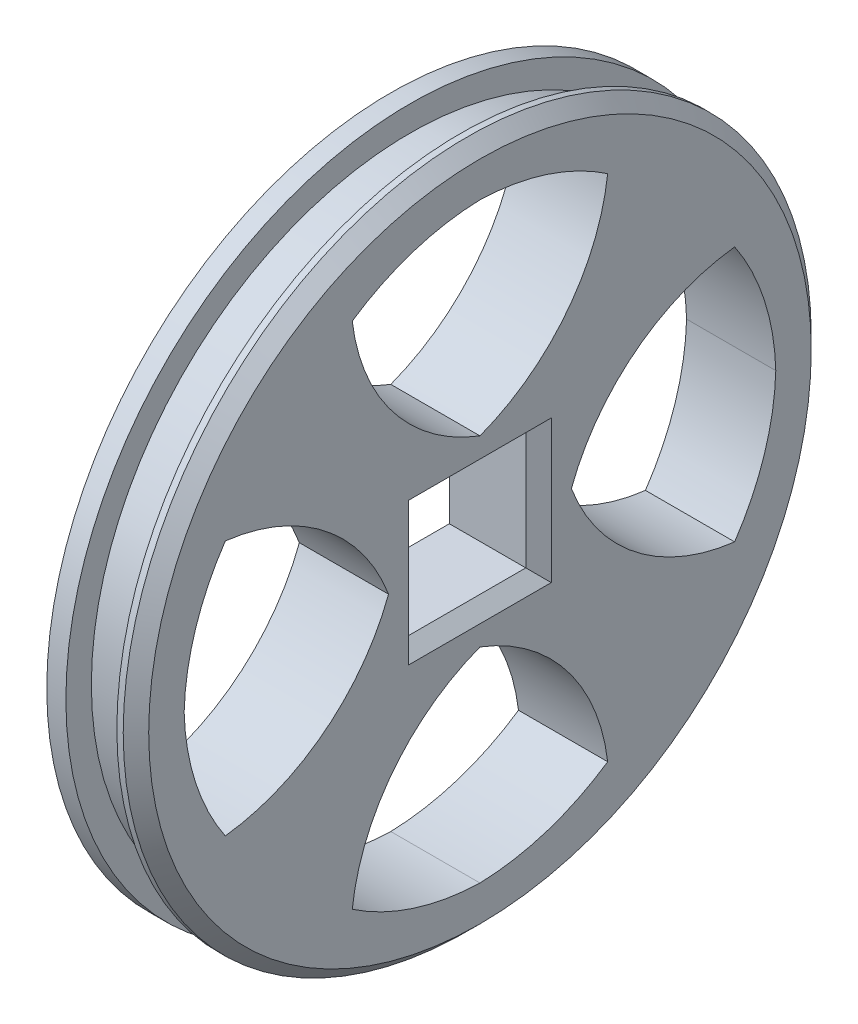
from build123d import *

# Parameters (mm, degrees)
SKETCH1_R               = 13.5
BOSS_EXTRUDE1_DEPTH     = 1.75
CUT_EXTRUDE1_DEPTH      = 20.17191957
CIRPATTERN1_COUNT       = 4
CUT_EXTRUDE2_DEPTH      = 20.17191957
CUT_EXTRUDE2_DEPTH_BACK = 20.17191957
SKETCH3_W               = 4.596194078
SKETCH3_H               = 4.596194078
CHAMFER1_SIZE           = 0.5
SKETCH4_R               = 13.5
SKETCH4_R_2             = 12.5
CUT_EXTRUDE3_DEPTH      = 1


with BuildPart() as part:
    # Sketch1 → Boss-Extrude1 (new, symmetric)
    with BuildSketch(Plane(origin=(0, 0, 0), x_dir=(0, 0, -1), z_dir=(1, 0, 0))):
        Circle(SKETCH1_R)
    extrude(amount=BOSS_EXTRUDE1_DEPTH, both=True)

    # Sketch2 → Cut-Extrude1 (cut, symmetric)
    with BuildSketch(Plane(origin=(0, 0, 0), x_dir=(0, 0, -1), z_dir=(1, 0, 0))):
        with BuildLine():
            ThreePointArc((0, 3.587478321), (-3.402339743, 6.089548883), (-5.012219469, 9.99397715))
            ThreePointArc((-5.012219469, 9.99397715), (-2.621563936, 11.159720287), (0, 11.6087119))
            ThreePointArc((0, 11.6087119), (2.621563936, 11.159720287), (5.012219469, 9.99397715))
            ThreePointArc((5.012219469, 9.99397715), (3.402339743, 6.089548883), (0, 3.587478321))
        make_face()
    cut_extrude1 = extrude(amount=CUT_EXTRUDE1_DEPTH, both=True, mode=Mode.SUBTRACT)

    # CirPattern1: Cut-Extrude1 ×4 about axis
    cirpattern1_axis = Axis((1.75, 0, 0), (-1, 0, 0))
    for i in range(1, CIRPATTERN1_COUNT):
        add(cut_extrude1.rotate(cirpattern1_axis, i * 360 / CIRPATTERN1_COUNT), mode=Mode.SUBTRACT)

    # Sketch3 → Cut-Extrude2 (cut, two sides: drawn at the far end of the back side and taken through both)
    with BuildSketch(Plane(origin=(0, 0, 0), x_dir=(0, 0, -1), z_dir=(1, 0, 0)).offset(-CUT_EXTRUDE2_DEPTH_BACK)):
        Rectangle(SKETCH3_W, SKETCH3_H)
    extrude(amount=CUT_EXTRUDE2_DEPTH + CUT_EXTRUDE2_DEPTH_BACK, mode=Mode.SUBTRACT)

    # Chamfer1
    chamfer1_edges = [part.edges().sort_by_distance(p)[0] for p in [
        (1.75, 0, 2.298097039),
        (1.75, -2.298097039, 0),
        (1.75, 2.298097039, 0),
        (1.75, 0, -2.298097039),
        (1.75, 0, 13.5),
    ]]
    chamfer(chamfer1_edges, length=CHAMFER1_SIZE)

    # Sketch4 → Cut-Extrude3 (cut, symmetric)
    with BuildSketch(Plane(origin=(0, 0, 0), x_dir=(0, 0, -1), z_dir=(1, 0, 0))):
        Circle(SKETCH4_R)
        Circle(SKETCH4_R_2, mode=Mode.SUBTRACT)
    extrude(amount=CUT_EXTRUDE3_DEPTH, both=True, mode=Mode.SUBTRACT)


solid = part.part
